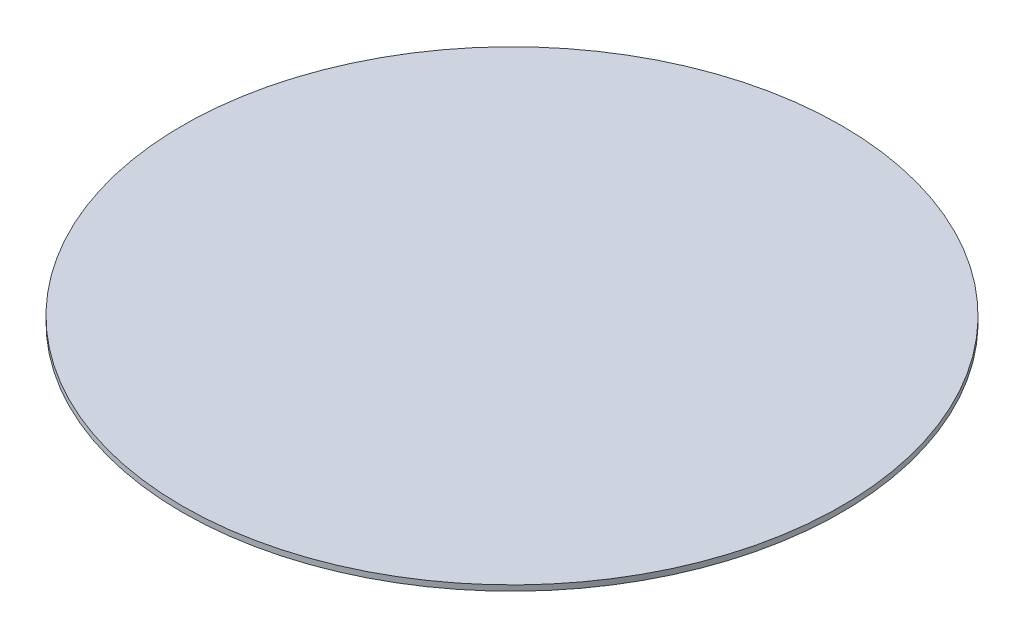
from build123d import *

# Parameters (mm, degrees)
SKETCH2_R           = 304.8
BOSS_EXTRUDE1_DEPTH = 5.08


with BuildPart() as part:
    # Sketch2 → Boss-Extrude1 (new body)
    with BuildSketch(Plane(origin=(0, 0, 0), x_dir=(1, 0, 0), z_dir=(0, 1, 0))):
        Circle(SKETCH2_R)
    extrude(amount=BOSS_EXTRUDE1_DEPTH)


solid = part.part
